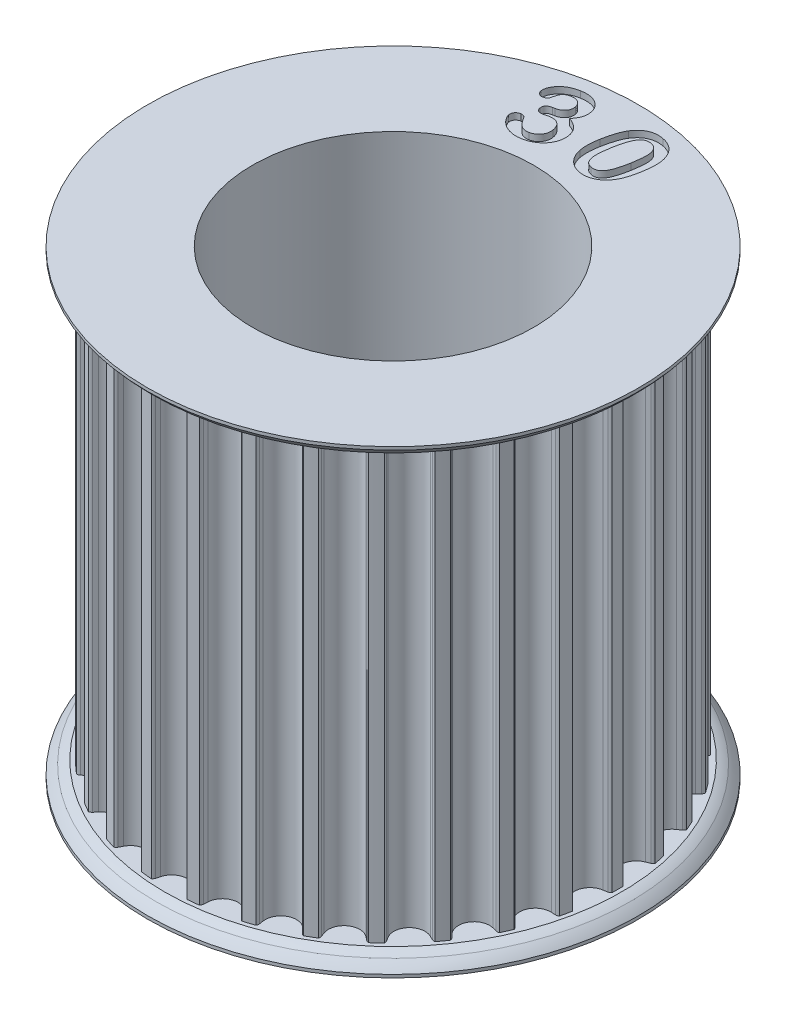
from build123d import *

# Parameters (mm, degrees)
SKETCH1_R                    = 13.942945337
TOOTHOD_DEPTH                = 13.335
TOOTHPROFILE_DEPTH           = 24.804068441
TOOTHPATTERN_COUNT           = 30
BORE_DEPTH                   = 26.858226085
BORE_DEPTH_BACK              = 26.858226085
SKETCH7_R                    = 8.73125
LARGE_TOOTH_COUNT_DEPTH      = 36.791700504
LARGE_TOOTH_COUNT_DEPTH_BACK = 0.4
SKETCH14_W                   = 12.7
SKETCH14_H                   = 2.8829


with BuildPart() as part:
    # Sketch1 → ToothOD (new, symmetric)
    with BuildSketch(Plane(origin=(0, 0, 0), x_dir=(1, 0, 0), z_dir=(0, 1, 0))):
        Circle(SKETCH1_R)
    extrude(amount=TOOTHOD_DEPTH, both=True)

    # Sketch2 → ToothProfile (cut, symmetric)
    with BuildSketch(Plane(origin=(0, 0, 0), x_dir=(1, 0, 0), z_dir=(0, 1, 0))):
        with BuildLine():
            ThreePointArc((-0.937033068, 13.493007333), (-0.590385173, 12.974832723), (0, 12.774545337))
            ThreePointArc((0, 12.774545337), (0.590385173, 12.974832723), (0.937033068, 13.493007333))
            ThreePointArc((0.937033068, 13.493007333), (0.971699064, 13.619118795), (1.007805813, 13.744825337))
            ThreePointArc((1.007805813, 13.744825337), (1.04827578, 13.830028138), (1.113221937, 13.898433782))
            ThreePointArc((1.113221937, 13.898433782), (0, 13.942945337), (-1.113221937, 13.898433782))
            ThreePointArc((-1.113221937, 13.898433782), (-1.04827578, 13.830028138), (-1.007805813, 13.744825337))
            ThreePointArc((-1.007805813, 13.744825337), (-0.971699064, 13.619118795), (-0.937033068, 13.493007333))
        make_face()
    toothprofile = extrude(amount=TOOTHPROFILE_DEPTH, both=True, mode=Mode.SUBTRACT)

    # ToothPattern: ToothProfile ×30 about axis
    toothpattern_axis = Axis((0, 13.335, 0), (0, -1, 0))
    for i in range(1, TOOTHPATTERN_COUNT):
        add(toothprofile.rotate(toothpattern_axis, i * 360 / TOOTHPATTERN_COUNT), mode=Mode.SUBTRACT)

    # Sketch4 → Flange (revolve)
    with BuildSketch(Plane.XY):
        with BuildLine():
            Line((0, -13.335), (14.196945337, -13.335))
            ThreePointArc((14.196945337, -13.335), (14.471862303, -13.446433628), (14.732, -13.589))
            ThreePointArc((14.732, -13.589), (15.000284982, -13.828715018), (15.24, -14.097))
            Line((15.24, -14.097), (15.24, -14.2875))
            Line((15.24, -14.2875), (0, -14.2875))
            Line((0, -14.2875), (0, -13.335))
        make_face()
        with BuildLine():
            Line((15.24, 14.2875), (15.24, 14.097))
            ThreePointArc((15.24, 14.097), (15.000284982, 13.828715018), (14.732, 13.589))
            ThreePointArc((14.732, 13.589), (14.471862303, 13.446433628), (14.196945337, 13.335))
            Line((14.196945337, 13.335), (0, 13.335))
            Line((0, 13.335), (0, 14.2875))
            Line((0, 14.2875), (15.24, 14.2875))
        make_face()
    revolve(axis=Axis((0, 8.73125, 0), (0, -1, 0)))

    # Sketch7 → Bore (cut, two sides: drawn at the far end of the back side and taken through both)
    with BuildSketch(Plane.XZ.offset(-BORE_DEPTH_BACK)):
        Circle(SKETCH7_R)
    extrude(amount=BORE_DEPTH + BORE_DEPTH_BACK, mode=Mode.SUBTRACT)

    # Sketch9 → Large Tooth Count (cut, two sides: drawn at the far end of the back side and taken through both)
    # profile 1 of 2: a face of its own
    with BuildSketch(Plane(origin=(0, 14.2875, 0), x_dir=(1, 0, 0), z_dir=(0, 1, 0)).offset(-LARGE_TOOTH_COUNT_DEPTH_BACK)):
        with BuildLine():
            add(Edge.make_bspline(
                [(-2.395395166, 12.44030561), (-2.351764935, 12.449788273), (-2.26636482, 12.468349267), (-2.148342517, 12.521687794), (-2.042804555, 12.591006059), (-1.96740896, 12.663473497), (-1.915871931, 12.728738206), (-1.883660529, 12.781439315), (-1.858242003, 12.837454575), (-1.840411306, 12.896637263), (-1.829894588, 12.959037271), (-1.825356933, 13.024243133), (-1.828016507, 13.092828085), (-1.835316428, 13.138960651), (-1.839075635, 13.162717329)],
                knots=[0, 0, 0, 0, 1.56408417, 3.061477405, 4.516692484, 5.980328475, 6.71001621, 7.432406507, 8.143441474, 8.864242186, 9.596246751, 10.361021371, 11.155982632, 12, 12, 12, 12], degree=3))
            add(Edge.make_bspline(
                [(-1.839075635, 13.162717329), (-1.847468614, 13.198321462), (-1.863918276, 13.268103117), (-1.912945679, 13.363762957), (-1.979770738, 13.4477246), (-2.063508364, 13.518748482), (-2.161688264, 13.573950381), (-2.272366388, 13.606154076), (-2.39306776, 13.616531188), (-2.474963903, 13.604676737), (-2.517731885, 13.598486079)],
                knots=[0, 0, 0, 0, 0.970242947, 1.901609501, 2.831594879, 3.809017159, 4.805027202, 5.804681963, 6.853556249, 8, 8, 8, 8], degree=3))
            add(Edge.make_bspline(
                [(-2.517731885, 13.598486079), (-2.546415601, 13.592694971), (-2.601323677, 13.581609287), (-2.678208847, 13.55850786), (-2.746350603, 13.530836409), (-2.805384858, 13.497992457), (-2.855844248, 13.460479936), (-2.900373354, 13.421487835), (-2.937064484, 13.378096327), (-2.978986878, 13.315102944), (-3.020518734, 13.221832551), (-3.059478235, 13.098283973), (-3.093381877, 12.968046045), (-3.114639047, 12.880861708), (-3.124950635, 12.838569673)],
                knots=[0, 0, 0, 0, 0.994372717, 1.903487376, 2.72466848, 3.490292993, 4.192582868, 4.858964158, 5.497730828, 6.117954991, 7.426137334, 8.949273991, 10.520130824, 12, 12, 12, 12], degree=3))
            add(Edge.make_bspline(
                [(-3.124950635, 12.838569673), (-3.129102288, 12.828888525), (-3.137555782, 12.809176013), (-3.156946896, 12.781271911), (-3.184316211, 12.757087617), (-3.228365663, 12.724989234), (-3.296869514, 12.693279737), (-3.356792915, 12.679657358), (-3.388376416, 12.672477485)],
                knots=[0, 0, 0, 0, 0.583215557, 1.187529019, 1.864732099, 2.597558886, 4.206693834, 6, 6, 6, 6], degree=3))
            add(Edge.make_bspline(
                [(-3.388376416, 12.672477485), (-3.408006408, 12.670159859), (-3.447059185, 12.665549071), (-3.507022694, 12.67355228), (-3.566425146, 12.693523488), (-3.623655514, 12.725811297), (-3.677136394, 12.767570228), (-3.718303855, 12.823277744), (-3.750834042, 12.887407726), (-3.76148388, 12.935253341), (-3.766995166, 12.960013423)],
                knots=[0, 0, 0, 0, 0.895545026, 1.78163704, 2.722927117, 3.728259503, 4.757347425, 5.780279766, 6.851295854, 8, 8, 8, 8], degree=3))
            add(Edge.make_bspline(
                [(-3.766995166, 12.960013423), (-3.770411448, 12.985862618), (-3.777384046, 13.038620566), (-3.773919219, 13.121047331), (-3.759263587, 13.207335205), (-3.733005125, 13.296987906), (-3.696578666, 13.389099655), (-3.647932397, 13.480993304), (-3.588113382, 13.572735702), (-3.518084365, 13.664428947), (-3.436036471, 13.753650839), (-3.341843972, 13.838087605), (-3.234599648, 13.915677391), (-3.115927699, 13.987966339), (-2.986130398, 14.052791424), (-2.845920922, 14.108605922), (-2.695743201, 14.153101315), (-2.591436102, 14.174340706), (-2.538270166, 14.185166548)],
                knots=[0, 0, 0, 0, 0.657648442, 1.342253878, 2.074039585, 2.864148476, 3.697712609, 4.572156031, 5.485651204, 6.461680898, 7.483386968, 8.543039874, 9.651430748, 10.822328438, 12.049685541, 13.311901225, 14.629860395, 16, 16, 16, 16], degree=3))
            add(Edge.make_bspline(
                [(-2.538270166, 14.185166548), (-2.491323817, 14.192598445), (-2.399252753, 14.207173862), (-2.262542202, 14.218659249), (-2.130523977, 14.21615243), (-2.003510296, 14.205171913), (-1.88150585, 14.182798989), (-1.765492151, 14.149880101), (-1.655706619, 14.106812961), (-1.552939002, 14.053959346), (-1.457386459, 13.992879421), (-1.37142964, 13.922784448), (-1.294282136, 13.845573559), (-1.228614102, 13.759473777), (-1.172184525, 13.667230001), (-1.12544845, 13.569517), (-1.089148427, 13.465869789), (-1.073635459, 13.393899723), (-1.065764698, 13.357384517)],
                knots=[0, 0, 0, 0, 1.205963252, 2.365132143, 3.475536425, 4.552557823, 5.596986774, 6.617881568, 7.608112011, 8.584359298, 9.54600503, 10.480268389, 11.393565618, 12.30907766, 13.221030907, 14.133203077, 15.052849641, 16, 16, 16, 16], degree=3))
            add(Edge.make_bspline(
                [(-1.065764698, 13.357384517), (-1.058444517, 13.309874096), (-1.044223716, 13.217576343), (-1.046060272, 13.080838704), (-1.062999475, 12.95140843), (-1.100190083, 12.829006806), (-1.152753369, 12.710344301), (-1.218197892, 12.591451706), (-1.297956271, 12.471597027), (-1.359266437, 12.394328645), (-1.390805323, 12.35458061)],
                knots=[0, 0, 0, 0, 1.053632123, 2.04687467, 2.990381272, 3.91042597, 4.843946409, 5.835317206, 6.886454128, 8, 8, 8, 8], degree=3))
            add(Edge.make_bspline(
                [(-1.390805323, 12.35458061), (-1.350412041, 12.340545314), (-1.270980886, 12.312945681), (-1.157752588, 12.262979632), (-1.052586502, 12.206626181), (-0.956144809, 12.143795096), (-0.867013097, 12.07655175), (-0.788401054, 12.001417094), (-0.716721652, 11.921931915), (-0.655517404, 11.83490394), (-0.602231291, 11.742811281), (-0.559592513, 11.644667954), (-0.524881708, 11.541361692), (-0.509910371, 11.46953943), (-0.502301416, 11.43303686)],
                knots=[0, 0, 0, 0, 1.139891914, 2.24153439, 3.296229475, 4.31773043, 5.308329865, 6.268443975, 7.212979858, 8.157782482, 9.099914282, 10.045216846, 11.006511264, 12, 12, 12, 12], degree=3))
            add(Edge.make_bspline(
                [(-0.502301416, 11.43303686), (-0.495319451, 11.388490119), (-0.481414307, 11.299771707), (-0.478916202, 11.164667165), (-0.488260491, 11.029415833), (-0.51276627, 10.894860542), (-0.549846959, 10.762327063), (-0.602249742, 10.634138329), (-0.667869204, 10.510393731), (-0.746222597, 10.391484268), (-0.838347041, 10.280067973), (-0.942787724, 10.17663575), (-1.059215889, 10.081986318), (-1.186989884, 9.996266633), (-1.325681923, 9.920701304), (-1.475651654, 9.858916788), (-1.635068246, 9.806633217), (-1.746512528, 9.78436586), (-1.803356885, 9.773007954)],
                knots=[0, 0, 0, 0, 0.919196757, 1.830654129, 2.750292315, 3.682047259, 4.616530511, 5.553871909, 6.502170786, 7.470871317, 8.454707972, 9.446890999, 10.465768377, 11.511964047, 12.582837701, 13.682741819, 14.818036711, 16, 16, 16, 16], degree=3))
            add(Edge.make_bspline(
                [(-1.803356885, 9.773007954), (-1.861273881, 9.764095157), (-1.97457734, 9.746658985), (-2.143413115, 9.740832432), (-2.305966452, 9.751048954), (-2.461225746, 9.778889999), (-2.606979598, 9.821119725), (-2.742928406, 9.873090337), (-2.868308727, 9.934276457), (-2.981900004, 10.005903776), (-3.083286845, 10.085279788), (-3.175837052, 10.166704637), (-3.256567319, 10.253286516), (-3.326556915, 10.341337364), (-3.383639504, 10.428572924), (-3.428783069, 10.510279282), (-3.462785872, 10.585170072), (-3.474766814, 10.634802087), (-3.480352198, 10.657939985)],
                knots=[0, 0, 0, 0, 1.358988971, 2.658600414, 3.911700577, 5.132627013, 6.311151581, 7.428568411, 8.506776026, 9.543649576, 10.538503265, 11.492538343, 12.401569204, 13.281931069, 14.10006001, 14.817332809, 15.448653585, 16, 16, 16, 16], degree=3))
            add(Edge.make_bspline(
                [(-3.480352198, 10.657939985), (-3.483746984, 10.68497257), (-3.490277506, 10.736974917), (-3.483346924, 10.814189742), (-3.459407148, 10.885488216), (-3.420429227, 10.949801807), (-3.370073369, 11.006058136), (-3.308307685, 11.050542415), (-3.238271172, 11.084475844), (-3.186891971, 11.095909843), (-3.160669385, 11.101745454)],
                knots=[0, 0, 0, 0, 1.065165672, 2.049049875, 3.00773798, 3.985592617, 4.976224793, 5.944087156, 6.950716419, 8, 8, 8, 8], degree=3))
            add(Edge.make_bspline(
                [(-3.160669385, 11.101745454), (-3.132597094, 11.104682386), (-3.07565053, 11.110640153), (-3.005449066, 11.091014031), (-2.953679925, 11.068571016), (-2.91939304, 11.047595496), (-2.891337116, 11.023070197), (-2.877833025, 11.003226451), (-2.87134751, 10.993696235)],
                knots=[0, 0, 0, 0, 1.550673656, 3.145647615, 3.957272918, 4.675311549, 5.363801208, 6, 6, 6, 6], degree=3))
            add(Edge.make_bspline(
                [(-2.87134751, 10.993696235), (-2.834765451, 10.934439869), (-2.765769991, 10.822679615), (-2.654254449, 10.673931939), (-2.546873402, 10.549804547), (-2.454600564, 10.465849729), (-2.379391167, 10.412984746), (-2.320630434, 10.38270277), (-2.259082437, 10.358414541), (-2.19377006, 10.341195919), (-2.12514281, 10.331648111), (-2.053345183, 10.329022341), (-1.978350806, 10.333749213), (-1.927728345, 10.341432664), (-1.901583448, 10.345400923)],
                knots=[0, 0, 0, 0, 1.989651524, 3.75257504, 5.30775678, 6.675689646, 7.305821198, 7.929950262, 8.560368956, 9.193937615, 9.855728221, 10.536870827, 11.244340126, 12, 12, 12, 12], degree=3))
            add(Edge.make_bspline(
                [(-1.901583448, 10.345400923), (-1.871644399, 10.352199583), (-1.811653801, 10.36582245), (-1.724531025, 10.397969414), (-1.641916359, 10.442636299), (-1.563158271, 10.496780316), (-1.491100009, 10.561890428), (-1.427079449, 10.636365346), (-1.373201458, 10.72071369), (-1.328532708, 10.813025229), (-1.296080307, 10.912955075), (-1.279366413, 11.018302819), (-1.277092498, 11.127852865), (-1.287926429, 11.200953457), (-1.293471729, 11.238369673)],
                knots=[0, 0, 0, 0, 0.918783497, 1.841019456, 2.770121856, 3.724533536, 4.696473957, 5.670047891, 6.656552307, 7.685126467, 8.733743146, 9.79028542, 10.868967352, 12, 12, 12, 12], degree=3))
            add(Edge.make_bspline(
                [(-1.293471729, 11.238369673), (-1.298936686, 11.265876176), (-1.30961674, 11.319631579), (-1.333478309, 11.396401406), (-1.360287624, 11.468479114), (-1.394965812, 11.533732243), (-1.433076599, 11.593785038), (-1.476357011, 11.648422925), (-1.525805682, 11.69629192), (-1.579318811, 11.739547501), (-1.637253652, 11.775881164), (-1.698731759, 11.806115638), (-1.76434029, 11.827990482), (-1.83303783, 11.844288015), (-1.905487999, 11.853175874), (-1.98114044, 11.854782163), (-2.060573072, 11.849194939), (-2.114159971, 11.840923764), (-2.141792041, 11.836658735)],
                knots=[0, 0, 0, 0, 1.142167213, 2.232114242, 3.272952444, 4.271354239, 5.237162538, 6.16931723, 7.104388237, 8.036542928, 8.968855492, 9.885808178, 10.82190168, 11.781211808, 12.759285311, 13.790748962, 14.860800298, 16, 16, 16, 16], degree=3))
            add(Edge.make_bspline(
                [(-2.141792041, 11.836658735), (-2.152794304, 11.834231238), (-2.177762529, 11.828722342), (-2.219583134, 11.820746399), (-2.268450918, 11.806036359), (-2.322602613, 11.792515486), (-2.374969303, 11.777315582), (-2.420194021, 11.766479519), (-2.454197188, 11.756940782), (-2.473367184, 11.752663579), (-2.481120166, 11.750933735)],
                knots=[0, 0, 0, 0, 0.772488785, 1.753064323, 2.916415325, 4.267721891, 5.579625089, 6.653636691, 7.455485957, 8, 8, 8, 8], degree=3))
            add(Edge.make_bspline(
                [(-2.481120166, 11.750933735), (-2.506960456, 11.746913438), (-2.556158075, 11.739259148), (-2.627480161, 11.7445519), (-2.692385424, 11.758886393), (-2.748894318, 11.788116673), (-2.797532533, 11.827971419), (-2.835684342, 11.879578873), (-2.863495022, 11.941556302), (-2.873931957, 11.987031385), (-2.879384229, 12.010787642)],
                knots=[0, 0, 0, 0, 1.158395447, 2.205482207, 3.158342672, 4.093034092, 5.004217035, 5.930162721, 6.91871368, 8, 8, 8, 8], degree=3))
            add(Edge.make_bspline(
                [(-2.879384229, 12.010787642), (-2.882631581, 12.034581517), (-2.888938576, 12.080793902), (-2.878805561, 12.149340934), (-2.856720158, 12.213565122), (-2.817758689, 12.271771874), (-2.764205594, 12.323365118), (-2.69486753, 12.365228304), (-2.61067647, 12.39742537), (-2.548927529, 12.410824563), (-2.515945948, 12.417981392)],
                knots=[0, 0, 0, 0, 0.930670598, 1.807545321, 2.668967297, 3.556120476, 4.506850782, 5.542439393, 6.687358266, 8, 8, 8, 8], degree=3))
            Line((-2.515945948, 12.417981392), (-2.395395166, 12.44030561))
        make_face()
    # profile 2 of 2: a face of its own
    with BuildSketch(Plane(origin=(0, 14.2875, 0), x_dir=(1, 0, 0), z_dir=(0, 1, 0)).offset(-LARGE_TOOTH_COUNT_DEPTH_BACK)):
        with BuildLine():
            add(Edge.make_bspline(
                [(3.7004625, 11.677153906), (3.686264675, 11.601404519), (3.658870865, 11.455250838), (3.60823368, 11.246398968), (3.555331302, 11.054842095), (3.497140597, 10.879874057), (3.43226392, 10.718370387), (3.354284746, 10.5696501), (3.267863441, 10.429406438), (3.200079147, 10.344222093), (3.166467187, 10.301982031)],
                knots=[0, 0, 0, 0, 1.239292749, 2.391137464, 3.455110319, 4.434576526, 5.35558113, 6.250576262, 7.132519381, 8, 8, 8, 8], degree=3))
            add(Edge.make_bspline(
                [(3.166467187, 10.301982031), (3.144198164, 10.275762567), (3.099982848, 10.223703623), (3.028150759, 10.152099925), (2.955162603, 10.084262728), (2.878202286, 10.023683343), (2.798344121, 9.969152553), (2.716313748, 9.919700373), (2.631008556, 9.876989925), (2.515006197, 9.826838731), (2.364496556, 9.780916237), (2.178286013, 9.751180687), (1.987209688, 9.746705952), (1.860205836, 9.764969839), (1.795760156, 9.7742375)],
                knots=[0, 0, 0, 0, 0.801914036, 1.592206392, 2.363614895, 3.12467816, 3.873679032, 4.617741915, 5.356605588, 6.096739935, 7.563535306, 9.011766561, 10.483677989, 12, 12, 12, 12], degree=3))
            add(Edge.make_bspline(
                [(1.795760156, 9.7742375), (1.758691219, 9.781631242), (1.685306753, 9.796268451), (1.579017325, 9.829261717), (1.47669898, 9.867783469), (1.380044445, 9.916590329), (1.285561627, 9.968935939), (1.19738272, 10.03240735), (1.113160926, 10.102133163), (1.033456371, 10.178910635), (0.960133443, 10.26276729), (0.891273319, 10.351207984), (0.831227587, 10.446296886), (0.776093193, 10.545504009), (0.728929808, 10.650561093), (0.688129265, 10.760416841), (0.652394743, 10.875273666), (0.635471729, 10.954585081), (0.626864062, 10.994925781)],
                knots=[0, 0, 0, 0, 1.006831006, 1.993198655, 2.962670514, 3.917125603, 4.876579595, 5.838523297, 6.807605523, 7.789496056, 8.784377988, 9.774567055, 10.773710418, 11.778570219, 12.797611708, 13.839467994, 14.90107403, 16, 16, 16, 16], degree=3))
            add(Edge.make_bspline(
                [(0.626864062, 10.994925781), (0.619759274, 11.038311971), (0.605309332, 11.126552166), (0.593814246, 11.262326323), (0.586896602, 11.40293425), (0.589152193, 11.548709409), (0.598648225, 11.69935456), (0.612502788, 11.855226338), (0.63412349, 12.015735441), (0.65299437, 12.123994877), (0.662582812, 12.179002344)],
                knots=[0, 0, 0, 0, 0.885671199, 1.801305883, 2.744009489, 3.721842217, 4.73736564, 5.785511931, 6.874801293, 8, 8, 8, 8], degree=3))
            add(Edge.make_bspline(
                [(0.662582812, 12.179002344), (0.67581353, 12.249342885), (0.701685694, 12.38689113), (0.747177039, 12.586095152), (0.796532307, 12.77366033), (0.848666183, 12.949364152), (0.905121765, 13.112699737), (0.967526733, 13.262167279), (1.031048043, 13.399729724), (1.08126072, 13.48342074), (1.105495312, 13.523813281)],
                knots=[0, 0, 0, 0, 1.20660685, 2.359473668, 3.444007557, 4.475997896, 5.44888863, 6.355661217, 7.206378115, 8, 8, 8, 8], degree=3))
            add(Edge.make_bspline(
                [(1.105495312, 13.523813281), (1.126834416, 13.556524286), (1.168832216, 13.62090329), (1.237568178, 13.7114371), (1.311190111, 13.793654963), (1.38803844, 13.868988013), (1.468633631, 13.937022551), (1.552525179, 13.998072286), (1.640742164, 14.051107199), (1.732849104, 14.096474687), (1.827852868, 14.135111111), (1.926359063, 14.164557494), (2.026980006, 14.186607394), (2.130423165, 14.202480291), (2.236825853, 14.208279031), (2.345683237, 14.206147175), (2.457347204, 14.197656756), (2.53193532, 14.185467192), (2.569964062, 14.179252344)],
                knots=[0, 0, 0, 0, 1.092656575, 2.150473306, 3.176936881, 4.178220762, 5.159348138, 6.12565659, 7.078409122, 8.035701623, 8.996177392, 9.944733961, 10.908670395, 11.876915267, 12.869780463, 13.886055898, 14.922205845, 16, 16, 16, 16], degree=3))
            add(Edge.make_bspline(
                [(2.569964062, 14.179252344), (2.619624638, 14.169226826), (2.716840932, 14.14960072), (2.855875094, 14.103943551), (2.985902625, 14.04899947), (3.106389503, 13.982386476), (3.217471903, 13.905565708), (3.318837426, 13.818133593), (3.411769076, 13.721779129), (3.492574376, 13.613505622), (3.565776041, 13.496705298), (3.628707217, 13.369762396), (3.683047683, 13.233001098), (3.710511229, 13.137130565), (3.724572656, 13.088044531)],
                knots=[0, 0, 0, 0, 1.079729077, 2.11369401, 3.114862735, 4.086675933, 5.044705033, 5.990156637, 6.93763101, 7.893743987, 8.866158368, 9.874067695, 10.911515541, 12, 12, 12, 12], degree=3))
            add(Edge.make_bspline(
                [(3.724572656, 13.088044531), (3.735099244, 13.042639356), (3.756896756, 12.948618401), (3.776692586, 12.799831487), (3.786882924, 12.639950564), (3.788716644, 12.468830024), (3.780101474, 12.286771755), (3.762793048, 12.093481855), (3.737219973, 11.888738889), (3.712960493, 11.749095406), (3.7004625, 11.677153906)],
                knots=[0, 0, 0, 0, 0.786691818, 1.629010692, 2.530719007, 3.490774846, 4.517115952, 5.606966069, 6.767157296, 8, 8, 8, 8], degree=3))
        make_face()
        with BuildLine():
            add(Edge.make_bspline(
                [(2.910185156, 11.880750781), (2.924410495, 11.964603932), (2.951486621, 12.124207756), (2.981874031, 12.353435144), (2.998161754, 12.560314022), (3.002720248, 12.745834185), (2.993973814, 12.911553595), (2.969933101, 13.058716639), (2.929909935, 13.187754947), (2.874474497, 13.299155576), (2.801281854, 13.393285072), (2.706839088, 13.465754997), (2.594968943, 13.521017292), (2.511607524, 13.539292631), (2.468165625, 13.548816406)],
                knots=[0, 0, 0, 0, 1.58388521, 3.014724367, 4.304646265, 5.446791372, 6.468588601, 7.390852584, 8.216588302, 8.975197153, 9.697217003, 10.415802656, 11.174431761, 12, 12, 12, 12], degree=3))
            add(Edge.make_bspline(
                [(2.468165625, 13.548816406), (2.436099139, 13.553635955), (2.373958902, 13.562975546), (2.28175461, 13.560981921), (2.19488034, 13.545989423), (2.113334219, 13.517012945), (2.037360483, 13.474327837), (1.967074016, 13.41802768), (1.902473026, 13.348317888), (1.843437621, 13.265140408), (1.789523086, 13.168320816), (1.73651258, 13.059109551), (1.687078599, 12.935681177), (1.639915098, 12.798842122), (1.595270597, 12.648373065), (1.553834599, 12.483761428), (1.513386631, 12.30550906), (1.489963339, 12.181465967), (1.477863281, 12.1173875)],
                knots=[0, 0, 0, 0, 0.799431854, 1.549183897, 2.265673805, 2.967656902, 3.675043338, 4.407302646, 5.182031398, 6.014136202, 6.91929923, 7.915230763, 9.009728297, 10.199692224, 11.487861376, 12.88351287, 14.390077883, 16, 16, 16, 16], degree=3))
            add(Edge.make_bspline(
                [(1.477863281, 12.1173875), (1.469909645, 12.073370146), (1.454350245, 11.987260657), (1.435180844, 11.860614905), (1.417742779, 11.739855671), (1.404360242, 11.62491711), (1.39461089, 11.515612691), (1.387442469, 11.412010626), (1.382646763, 11.314060687), (1.381493996, 11.194285407), (1.387489531, 11.056488406), (1.412169879, 10.905691302), (1.451053834, 10.773132799), (1.5049595, 10.658369923), (1.577720936, 10.562545304), (1.669426393, 10.488079638), (1.778682067, 10.432487804), (1.859764301, 10.414203177), (1.902023437, 10.404673438)],
                knots=[0, 0, 0, 0, 1.091371878, 2.135009643, 3.125165946, 4.06839428, 4.95806396, 5.802562953, 6.602308193, 7.350423399, 8.725033855, 9.962033809, 11.0695267, 12.086256579, 13.039221506, 13.978470784, 14.946402002, 16, 16, 16, 16], degree=3))
            add(Edge.make_bspline(
                [(1.902023437, 10.404673438), (1.924587882, 10.400887995), (1.968620661, 10.393500995), (2.034218783, 10.391230619), (2.097039875, 10.394553102), (2.157236001, 10.404407116), (2.214533549, 10.420356358), (2.269153619, 10.443080638), (2.320855396, 10.472717028), (2.387733076, 10.521499558), (2.464921351, 10.599186031), (2.548360565, 10.711042387), (2.622168921, 10.845258606), (2.675987846, 10.971459008), (2.716902488, 11.083645194), (2.746809929, 11.177012017), (2.776420898, 11.277314053), (2.804882222, 11.384536629), (2.832457187, 11.498592767), (2.859088379, 11.619852486), (2.886241044, 11.747671693), (2.902089886, 11.835758045), (2.910185156, 11.880750781)],
                knots=[0, 0, 0, 0, 0.687381122, 1.341371444, 1.968978725, 2.576739265, 3.171843679, 3.753672719, 4.350994545, 4.959743046, 6.238357749, 7.625796228, 9.144683334, 10.832503885, 11.74714998, 12.735073917, 13.780221821, 14.891903747, 16.070782631, 17.308674638, 18.625325182, 20, 20, 20, 20], degree=3))
        make_face(mode=Mode.SUBTRACT)
    extrude(amount=LARGE_TOOTH_COUNT_DEPTH + LARGE_TOOTH_COUNT_DEPTH_BACK, mode=Mode.SUBTRACT)

    # Sketch14 → Cut-Revolve1 (revolve, cut)
    with BuildSketch(Plane.XY):
        with Locations((6.35, -12.84605)):
            Rectangle(SKETCH14_W, SKETCH14_H)
    revolve(axis=Axis((0, 0, 0), (0, 1, 0)), mode=Mode.SUBTRACT)


solid = part.part
